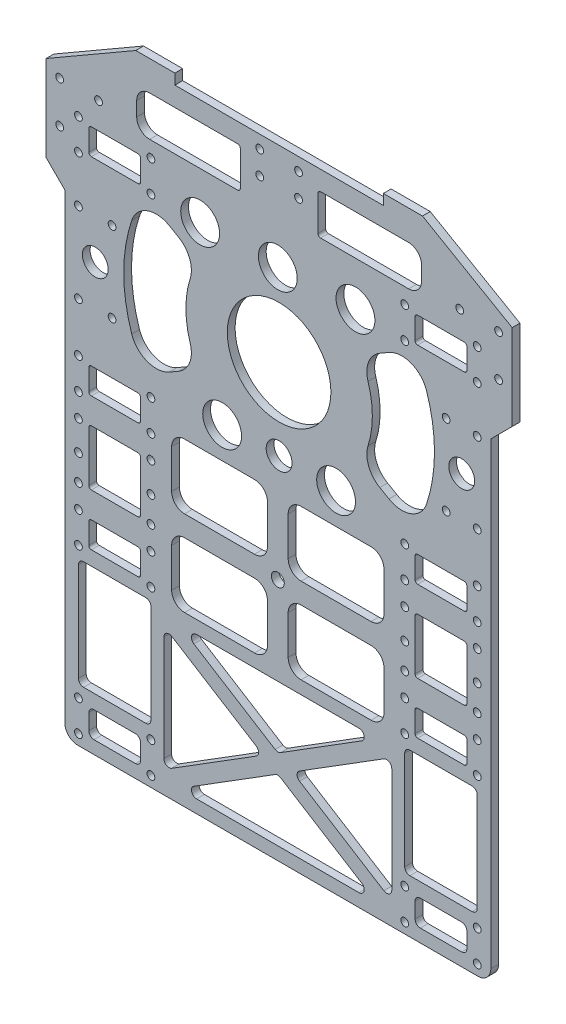
from build123d import *

# Parameters (mm, degrees)
SKETCH_1_W           = 201
SKETCH_1_H           = 195
EXTRUDE_1_DEPTH      = 3
CHAMFER_1_SIZE       = 25
CHAMFER_1_SIZE2      = 43.301270189
CUT_EXTRUDE_6_DEPTH  = 10
SKETCH_15_R          = 20
CUT_EXTRUDE_7_DEPTH  = 10
SKETCH_16_W          = 37
SKETCH_16_H          = 29.94024066
CUT_EXTRUDE_9_DEPTH  = 10
FILLET_1_R           = 5
FILLET_4_R           = 10
SKETCH_17_R          = 1.5
CUT_EXTRUDE_10_DEPTH = 5
EXTRUDE_2_DEPTH      = 3
CHAMFER_3_SIZE       = 10
SKETCH_27_W          = 20
SKETCH_27_H          = 10
CUT_EXTRUDE_16_DEPTH = 9
FILLET_6_R           = 1
SKETCH_30_W          = 106.00409404
SKETCH_30_H          = 23.924993188
SKETCH_30_W_2        = 94.165842559
SKETCH_30_H_2        = 28.711237986
SKETCH_30_W_3        = 217.804214652
SKETCH_30_H_3        = 38.306819749
CUT_EXTRUDE_18_DEPTH = 10
EXTRUDE_3_DEPTH      = 3
FILLET_7_R           = 2
CUT_EXTRUDE_19_DEPTH = 3
FILLET_8_R           = 5
FILLET_9_R           = 5
SKETCH_34_W          = 20
SKETCH_34_H          = 15
SKETCH_34_H_2        = 17.625664051
EXTRUDE_4_DEPTH      = 3
FILLET_12_R          = 10
SKETCH_35_R          = 1.5
CUT_EXTRUDE_21_DEPTH = 10
CUT_EXTRUDE_22_DEPTH = 10
FILLET_13_R          = 6
CUT_EXTRUDE_23_DEPTH = 10
FILLET_14_R          = 3
SKETCH_40_W          = 40
SKETCH_40_H          = 50
SKETCH_40_W_2        = 55
CUT_EXTRUDE_24_DEPTH = 10
SKETCH_41_W          = 15
SKETCH_41_H          = 40
SKETCH_41_H_2        = 32.09
CUT_EXTRUDE_25_DEPTH = 10
CUT_EXTRUDE_26_DEPTH = 10
SKETCH_43_W          = 180.29253832
SKETCH_43_H          = 3
EXTRUDE_6_DEPTH      = 4
SKETCH_44_W          = 3
SKETCH_44_H          = 4
EXTRUDE_7_DEPTH      = 4
EXTRUDE_8_DEPTH      = 3
FILLET_17_R          = 7
FILLET_18_R          = 9.01
SKETCH_46_W          = 40
SKETCH_46_H          = 15.5
CUT_EXTRUDE_27_DEPTH = 3
FILLET_21_R          = 60
FILLET_22_R          = 40
SKETCH_47_R          = 7.5
CUT_EXTRUDE_28_DEPTH = 3
SKETCH_48_W          = 166.350814393
SKETCH_48_H          = 15.90954676
CUT_EXTRUDE_29_DEPTH = 3
SKETCH_49_R          = 5
SKETCH_49_R_2        = 7.5
CUT_EXTRUDE_30_DEPTH = 3
SKETCH_51_W          = 20
SKETCH_51_H          = 50
EXTRUDE_9_DEPTH      = 3
SKETCH_52_W          = 8
SKETCH_52_H          = 8
CUT_EXTRUDE_31_DEPTH = 10
CUT_EXTRUDE_33_DEPTH = 10
SKETCH_56_W          = 43.293098597
SKETCH_56_H          = 76.973902965
CUT_EXTRUDE_34_DEPTH = 142.69186165
SKETCH_57_W          = 80.5
SKETCH_57_H          = 8.056183634
CUT_EXTRUDE_35_DEPTH = 121.593616884
CUT_EXTRUDE_36_DEPTH = 121.593616884
FILLET_25_R          = 10
SKETCH_59_R          = 1.5
CUT_EXTRUDE_37_DEPTH = 3
CHAMFER_5_SIZE       = 20
CHAMFER_5_SIZE2      = 34.641016151
CHAMFER_6_SIZE       = 20
CHAMFER_6_SIZE2      = 34.641016151
FILLET_26_R          = 5
CHAMFER_7_SIZE       = 10
EXTRUDE_START        = -3
EXTRUDE_10_DEPTH     = 3
SKETCH_62_W          = 180
SKETCH_62_H          = 3
EXTRUDE_11_DEPTH     = 50
SKETCH_63_W          = 20
SKETCH_63_H          = 10
SKETCH_63_R          = 1.5
CUT_EXTRUDE_38_DEPTH = 213.367228245
SKETCH_64_W          = 7.25
SKETCH_64_H          = 130.459459459
SKETCH_64_W_2        = 8.25
CUT_EXTRUDE_39_DEPTH = 213.367228245
SKETCH_65_W          = 20
SKETCH_65_H          = 21.459459459
SKETCH_65_R          = 1.5
CUT_EXTRUDE_40_DEPTH = 213.367228245
SKETCH_66_R          = 1.5
SKETCH_66_R_2        = 5
CUT_EXTRUDE_41_DEPTH = 213.367228245
CHAMFER_8_SIZE       = 8.25
CHAMFER_9_SIZE       = 7.25
FILLET_27_R          = 1
SKETCH_67_W          = 37
SKETCH_67_H          = 25.002895974
CUT_EXTRUDE_42_DEPTH = 10
FILLET_29_R          = 5
SKETCH_68_W          = 164.5
SKETCH_68_H          = 3
EXTRUDE_12_DEPTH     = 60
FILLET_31_R          = 5
SKETCH_70_R          = 2.5
CUT_EXTRUDE_44_DEPTH = 10
CUT_EXTRUDE_45_DEPTH = 3
FILLET_32_R          = 2
SKETCH_73_W          = 20
SKETCH_73_H          = 10
SKETCH_73_W_2        = 28
SKETCH_73_H_2        = 42
SKETCH_73_R          = 1.5
CUT_EXTRUDE_47_DEPTH = 259.498952301
FILLET_33_R          = 2
SKETCH_74_R          = 1.5
CUT_EXTRUDE_48_DEPTH = 259.498952301


# Some blends are built 0.0001 mm under size
with BuildPart() as part:
    # 草图1 → 凸台-拉伸1 (new body)
    with BuildSketch(Plane.XY):
        Rectangle(SKETCH_1_W, SKETCH_1_H)
    extrude(amount=EXTRUDE_1_DEPTH)

    # 倒角1
    chamfer_1_edges = [part.edges().sort_by_distance(p)[0] for p in [
        (-100.5, -97.5, 1.5),
    ]]
    chamfer_1_side = [part.faces().sort_by_distance(p)[0] for p in [
        (-100.5, 0, 1.5),
    ]]
    chamfer(chamfer_1_edges, length=CHAMFER_1_SIZE, length2=CHAMFER_1_SIZE2, reference=chamfer_1_side[0])

    # 草图14 → 切除-拉伸6 (cut)
    with BuildSketch(Plane(origin=(0, 0, 0), x_dir=(-1, 0, 0), z_dir=(0, 0, -1))):
        Polygon((-57.198729811, -97.5), (-100.5, -72.5), (-100.5, -97.5), align=None)
    extrude(amount=-CUT_EXTRUDE_6_DEPTH, mode=Mode.SUBTRACT)

    # 草图15 → 切除-拉伸7 (cut)
    with BuildSketch(Plane(origin=(0, 0, 0), x_dir=(-1, 0, 0), z_dir=(0, 0, -1))):
        with Locations((7, -5)):
            Circle(SKETCH_15_R)
        with BuildLine():
            Line((34.5, -77.5), (34.5, -97.5))
            Line((34.5, -97.5), (-20.5, -97.5))
            Line((-20.5, -97.5), (-20.5, -77.5))
            ThreePointArc((-20.5, -77.5), (7, -50), (34.5, -77.5))
        make_face()
    extrude(amount=-CUT_EXTRUDE_7_DEPTH, mode=Mode.SUBTRACT)

    # 草图16 → 切除-拉伸9 (cut)
    with BuildSketch(Plane(origin=(0, 0, 0), x_dir=(-1, 0, 0), z_dir=(0, 0, -1))):
        with Locations((6.00008928, 82.52987967)):
            Rectangle(SKETCH_16_W, SKETCH_16_H)
    extrude(amount=-CUT_EXTRUDE_9_DEPTH, mode=Mode.SUBTRACT)

    # 圆角1
    fillet_1_edges = [part.edges().sort_by_distance(p)[0] for p in [
        (12.49991072, 67.55975934, 1.5),
        (-24.50008928, 67.55975934, 1.5),
    ]]
    fillet(fillet_1_edges, radius=FILLET_1_R)

    # 圆角4
    fillet_4_edges = [part.edges().sort_by_distance(p)[0] for p in [
        (-34.5, -97.5, 1.5),
        (20.5, -97.5, 1.5),
    ]]
    fillet(fillet_4_edges, radius=FILLET_4_R)

    # 草图17 → 切除-拉伸10 (cut)
    with BuildSketch(Plane.XY.offset(3)):
        with Locations((0.5, 62.55975934)):
            Circle(SKETCH_17_R)
        with Locations((0.5, 53.55975934)):
            Circle(SKETCH_17_R)
        with Locations((-14.5, 53.55975934)):
            Circle(SKETCH_17_R)
        with Locations((-14.5, 62.55975934)):
            Circle(SKETCH_17_R)
    extrude(amount=-CUT_EXTRUDE_10_DEPTH, mode=Mode.SUBTRACT)

    # 草图19 → 凸台-拉伸2 (add)
    with BuildSketch(Plane.XY.offset(3)):
        with BuildLine():
            Line((107.337203466, 67.587851157), (100.5, 67.587851157))
            Line((100.5, 67.587851157), (100.5, 64.587851157))
            Line((100.5, 64.587851157), (115.5, 64.587851157))
            Line((115.5, 64.587851157), (115.5, 80.587851157))
            Line((115.5, 80.587851157), (100.5, 80.587851157))
            Line((100.5, 80.587851157), (100.5, 77.587851157))
            Line((100.5, 77.587851157), (107.337203466, 77.587851157))
            ThreePointArc((107.337203466, 77.587851157), (112.337203466, 72.587851157), (107.337203466, 67.587851157))
        make_face()
        with BuildLine():
            Line((100.5, 77.587851157), (100.5, 67.587851157))
            Line((100.5, 67.587851157), (107.337203466, 67.587851157))
            ThreePointArc((107.337203466, 67.587851157), (112.337203466, 72.587851157), (107.337203466, 77.587851157))
            Line((107.337203466, 77.587851157), (100.5, 77.587851157))
        make_face()
        with BuildLine():
            Line((-108.06494967, 74.962187106), (-100.5, 74.962187106))
            Line((-100.5, 74.962187106), (-100.5, 77.962187106))
            Line((-100.5, 77.962187106), (-116.5, 77.962187106))
            Line((-116.5, 77.962187106), (-116.5, 61.962187106))
            Line((-116.5, 61.962187106), (-100.5, 61.962187106))
            Line((-100.5, 61.962187106), (-100.5, 64.962187106))
            Line((-100.5, 64.962187106), (-108.06494967, 64.962187106))
            ThreePointArc((-108.06494967, 64.962187106), (-113.06494967, 69.962187106), (-108.06494967, 74.962187106))
        make_face()
        with BuildLine():
            Line((-100.5, 64.962187106), (-100.5, 74.962187106))
            Line((-100.5, 74.962187106), (-108.06494967, 74.962187106))
            ThreePointArc((-108.06494967, 74.962187106), (-113.06494967, 69.962187106), (-108.06494967, 64.962187106))
            Line((-108.06494967, 64.962187106), (-100.5, 64.962187106))
        make_face()
    extrude(amount=-EXTRUDE_2_DEPTH)

    # 倒角3
    chamfer_3_edges = [part.edges().sort_by_distance(p)[0] for p in [
        (100.5, 80.587851157, 1.5),
        (100.5, 64.587851157, 1.5),
        (-100.5, 61.962187106, 1.5),
        (-100.5, 77.962187106, 1.5),
    ]]
    chamfer(chamfer_3_edges, length=CHAMFER_3_SIZE)

    # 草图27 → 切除-拉伸16 (cut)
    with BuildSketch(Plane.XY.offset(3)):
        with Locations((-70.5, 32.5)):
            Rectangle(SKETCH_27_W, SKETCH_27_H)
        with Locations((-70.5, -47.5)):
            Rectangle(SKETCH_27_W, SKETCH_27_H)
        with Locations((55.5, -47.5)):
            Rectangle(SKETCH_27_W, SKETCH_27_H)
        with Locations((55.5, 32.5)):
            Rectangle(SKETCH_27_W, SKETCH_27_H)
    extrude(amount=-CUT_EXTRUDE_16_DEPTH, mode=Mode.SUBTRACT)

    # 圆角6
    fillet_6_edges = [part.edges().sort_by_distance(p)[0] for p in [
        (65.5, 37.5, 1.5),
        (65.5, 27.5, 1.5),
        (45.5, 27.5, 1.5),
        (45.5, 37.5, 1.5),
        (65.5, -42.5, 1.5),
        (65.5, -52.5, 1.5),
        (45.5, -52.5, 1.5),
        (45.5, -42.5, 1.5),
        (-60.5, -42.5, 1.5),
        (-60.5, -52.5, 1.5),
        (-80.5, -52.5, 1.5),
        (-80.5, -42.5, 1.5),
        (-60.5, 37.5, 1.5),
        (-60.5, 27.5, 1.5),
        (-80.5, 27.5, 1.5),
        (-80.5, 37.5, 1.5),
    ]]
    fillet(fillet_6_edges, radius=FILLET_6_R)

    # 草图30 → 切除-拉伸18 (cut)
    with BuildSketch(Plane.XY.offset(3)):
        with Locations((57.49795298, 92.550347751)):
            Rectangle(SKETCH_30_W, SKETCH_30_H)
        with Locations((-63.417078721, 92.317806099)):
            Rectangle(SKETCH_30_W_2, SKETCH_30_H_2)
        with Locations((8.402107326, -91.653409874)):
            Rectangle(SKETCH_30_W_3, SKETCH_30_H_3)
    extrude(amount=-CUT_EXTRUDE_18_DEPTH, mode=Mode.SUBTRACT)

    # 草图31 → 凸台-拉伸3 (add)
    with BuildSketch(Plane.XY.offset(3)):
        Polygon((-116.5, 61.962187106), (-100.5, 45.962187106), (-100.5, 51.962187106), (-110.5, 61.962187106), align=None)
        Polygon((115.5, 64.587851157), (100.5, 49.587851157), (100.5, 54.587851157), (110.5, 64.587851157), align=None)
    extrude(amount=-EXTRUDE_3_DEPTH)

    # 圆角7
    fillet_7_edges = [part.edges().sort_by_distance(p)[0] for p in [
        (115.5, 80.587851157, 1.5),
        (-116.5, 77.962187106, 1.5),
        (-24.50008928, 77.962187106, 1.5),
        (12.49991072, 80.587851157, 1.5),
    ]]
    fillet(fillet_7_edges, radius=FILLET_7_R)

    # 草图32 → 切除-拉伸19 (cut)
    with BuildSketch(Plane.XY.offset(3)):
        Polygon((-100.5, -72.5), (-100.5, -52.5), (-40.5, -72.5), align=None)
        Polygon((100.5, -72.5), (100.5, -52.5), (26.5, -72.5), align=None)
    extrude(amount=-CUT_EXTRUDE_19_DEPTH, mode=Mode.SUBTRACT)

    # 倒角4
    # the kernel refuses this chamfer: 12.476388681, 10 mm, written as the material it takes off along each edge
    with BuildSketch(Plane(origin=(20.041634566, -72.5, 26.497356815), x_dir=(-0.36639876698694906, 0.9304579214292517, 0), z_dir=(0, 0, -1))) as chamfer_4_piece_1:
        with BuildLine():
            Line((9.398942726, 0), (-3.299990577, 7.545636628))
            Line((-3.299990577, 7.545636628), (-3.53216567, 7.454209959))
            ThreePointArc((-3.53216567, 7.454209959), (-1.739907824, 3.737412261), (-0.232175094, -0.091426669))
            Line((-0.232175094, -0.091426669), (0.047689131, -0.244928268))
            ThreePointArc((0.047689131, -0.244928268), (4.6942867, 0.25159092), (9.36524124, -0.24724142))
            Line((9.36524124, -0.24724142), (9.398942726, 0))
        make_face()
    extrude(amount=49.99471363, mode=Mode.SUBTRACT)
    with BuildSketch(Plane(origin=(-34.041634566, -72.5, 26.497356815), x_dir=(-0.9993104470037873, -0.03712991393863708, 0), z_dir=(0, 0, -1))) as chamfer_4_piece_2:
        with BuildLine():
            Line((8.235688795, 0), (-3.766099375, 8.6114238))
            Line((-3.766099375, 8.6114238), (-3.979120942, 8.481477957))
            ThreePointArc((-3.979120942, 8.481477957), (-1.650461613, 4.401772606), (-0.243514956, -0.05444792))
            Line((-0.243514956, -0.05444792), (0.009264945, -0.249355711))
            ThreePointArc((0.009264945, -0.249355711), (4.121432356, -0.096565932), (8.244953739, -0.249355711))
            Line((8.244953739, -0.249355711), (8.235688795, 0))
        make_face()
    extrude(amount=49.99471363, mode=Mode.SUBTRACT)

    # 圆角8
    fillet_8_edges = [part.edges().sort_by_distance(p)[0] for p in [
        (-30.992270118, -64.060469704, 1.5),
        (16.992270118, -64.060469704, 1.5),
        (27.52125471, -72.223985214, 1.5),
        (-41.463164017, -72.178945328, 1.5),
    ]]
    fillet(fillet_8_edges, radius=FILLET_8_R)

    # 圆角9
    fillet_9_edges = [part.edges().sort_by_distance(p)[0] for p in [
        (-100.5, -52.5, 1.5),
        (100.5, -52.5, 1.5),
    ]]
    fillet(fillet_9_edges, radius=FILLET_9_R)

    # 草图34 → 凸台-拉伸4 (add)
    with BuildSketch(Plane(origin=(0, 0, 0), x_dir=(-1, 0, 0), z_dir=(0, 0, -1))):
        with Locations((-72.83991072, 88.087851157)):
            Rectangle(SKETCH_34_W, SKETCH_34_H)
        with Locations((84.84008928, 86.775019132)):
            Rectangle(SKETCH_34_W, SKETCH_34_H_2)
    extrude(amount=-EXTRUDE_4_DEPTH)

    # 圆角12
    fillet_12_edges = [part.edges().sort_by_distance(p)[0] for p in [
        (82.83991072, 80.587851157, 1.5),
        (62.83991072, 80.587851157, 1.5),
        (-94.84008928, 77.962187106, 1.5),
        (-74.84008928, 77.962187106, 1.5),
    ]]
    fillet(fillet_12_edges, radius=FILLET_12_R)

    # 草图35 → 切除-拉伸21 (cut)
    with BuildSketch(Plane(origin=(0, 0, 0), x_dir=(-1, 0, 0), z_dir=(0, 0, -1))):
        with Locations((-41.5, 38.5)):
            Circle(SKETCH_35_R)
        with Locations((-41.5, -53.5)):
            Circle(SKETCH_35_R)
        with Locations((-41.5, -41.5)):
            Circle(SKETCH_35_R)
        with Locations((-69.5, -41.5)):
            Circle(SKETCH_35_R)
        with Locations((-69.5, -53.5)):
            Circle(SKETCH_35_R)
        with Locations((84.5, 38.5)):
            Circle(SKETCH_35_R)
        with Locations((56.5, 26.5)):
            Circle(SKETCH_35_R)
        with Locations((56.5, 38.5)):
            Circle(SKETCH_35_R)
        with Locations((-69.5, 26.5)):
            Circle(SKETCH_35_R)
        with Locations((-69.5, 38.5)):
            Circle(SKETCH_35_R)
        with Locations((-41.5, 26.5)):
            Circle(SKETCH_35_R)
        with Locations((56.5, -53.5)):
            Circle(SKETCH_35_R)
        with Locations((56.5, -41.5)):
            Circle(SKETCH_35_R)
        with Locations((84.5, -53.5)):
            Circle(SKETCH_35_R)
        with Locations((84.5, -41.5)):
            Circle(SKETCH_35_R)
        with Locations((84.5, 26.5)):
            Circle(SKETCH_35_R)
    extrude(amount=-CUT_EXTRUDE_21_DEPTH, mode=Mode.SUBTRACT)

    # 草图38 → 切除-拉伸22 (cut)
    with BuildSketch(Plane.XY.offset(3)):
        Polygon((14.49991072, 67.55975934), (14.49991072, 80.587851157), (-26.613416478, 81.45380628), (-26.613416478, 67.55975934), align=None)
    extrude(amount=-CUT_EXTRUDE_22_DEPTH, mode=Mode.SUBTRACT)

    # 圆角13
    fillet_13_edges = [part.edges().sort_by_distance(p)[0] for p in [
        (14.49991072, 67.55975934, 1.5),
        (-26.613416478, 67.55975934, 1.5),
    ]]
    fillet(fillet_13_edges, radius=FILLET_13_R)

    # 草图39 → 切除-拉伸23 (cut)
    with BuildSketch(Plane.XY.offset(3)):
        Polygon((20.49991072, 80.587851157), (20.49991072, 67.587851157), (-30.7926276, 67.587851157), (-30.7926276, 84.869575288), (20.49991072, 84.869575288), align=None)
    extrude(amount=-CUT_EXTRUDE_23_DEPTH, mode=Mode.SUBTRACT)

    # 圆角14
    fillet_14_edges = [part.edges().sort_by_distance(p)[0] for p in [
        (20.49991072, 67.587851157, 1.5),
        (-30.7926276, 67.587851157, 1.5),
    ]]
    fillet(fillet_14_edges, radius=FILLET_14_R)

    # 草图40 → 切除-拉伸24 (cut)
    with BuildSketch(Plane.XY.offset(3)):
        with Locations((-80.5, -7.5)):
            Rectangle(SKETCH_40_W, SKETCH_40_H)
        with Locations((73, -7.5)):
            Rectangle(SKETCH_40_W_2, SKETCH_40_H)
    extrude(amount=-CUT_EXTRUDE_24_DEPTH, mode=Mode.SUBTRACT)

    # 草图41 → 切除-拉伸25 (cut)
    with BuildSketch(Plane.XY.offset(3)):
        with Locations((93, -52.5)):
            Rectangle(SKETCH_41_W, SKETCH_41_H)
        with Locations((93, 33.545)):
            Rectangle(SKETCH_41_W, SKETCH_41_H_2)
    extrude(amount=-CUT_EXTRUDE_25_DEPTH, mode=Mode.SUBTRACT)

    # 草图42 → 切除-拉伸26 (cut)
    with BuildSketch(Plane.XY.offset(3)):
        Polygon((-27.7926276, 67.587851157), (-87.7926276, 67.587851157), (-95.572555094, 77.962187106), (-104.84008928, 77.962187106), (-104.246385995, 83.985644331), (-97.769021468, 80.891119294), (-100.282319974, 112.192962905), (-22.186390259, 105.639458314), align=None)
        Polygon((17.49991072, 67.587851157), (92.49991072, 67.587851157), (92.49991072, 105.639458314), (9.662628015, 105.639458314), align=None)
    extrude(amount=-CUT_EXTRUDE_26_DEPTH, mode=Mode.SUBTRACT)

    # 草图43 → 凸台-拉伸6 (add)
    with BuildSketch(Plane(origin=(0, 67.587851157, 0), x_dir=(1, 0, 0), z_dir=(0, 1, 0))):
        with Locations((2.35364156, -1.5)):
            Rectangle(SKETCH_43_W, SKETCH_43_H)
    extrude(amount=EXTRUDE_6_DEPTH)

    # 草图44 → 凸台-拉伸7 (add)
    with BuildSketch(Plane.ZY.offset(87.7926276)):
        with Locations((1.5, 69.587851157)):
            Rectangle(SKETCH_44_W, SKETCH_44_H)
    extrude(amount=EXTRUDE_7_DEPTH)

    # 草图45 → 凸台-拉伸8 (add)
    with BuildSketch(Plane(origin=(0, 0, 0), x_dir=(-1, 0, 0), z_dir=(0, 0, -1))):
        Polygon((95.572555094, 77.962187106), (90.792309712, 71.587851157), (90.792309712, 77.962187106), align=None)
    extrude(amount=-EXTRUDE_8_DEPTH)

    # 圆角17
    # the kernel refuses this fillet: 7 mm, written as the material it adds along each edge
    with BuildSketch(Plane(origin=(-90.792309712, 71.587851157, 3), x_dir=(1, 0, 0), z_dir=(0, 0, -1))) as fillet_17_piece_1:
        with BuildLine():
            CenterArc((6.971982824, -7), FILLET_17_R, 90, 84.872026753)
            Line((0, -6.374335949), (-0.139439656, -6.361822668))
            ThreePointArc((-0.139439656, -6.361822668), (-0.14, -3.187167975), (-0.14, 0))
            Line((-0.14, 0), (0, 0.14))
            Line((0, 0.14), (6.971982824, 0.14))
            Line((6.971982824, 0.14), (6.971982824, 0))
        make_face()
    extrude(amount=3)

    # 圆角18
    # the kernel refuses this fillet: 9.01 mm, written as the material it adds along each edge
    with BuildSketch(Plane(origin=(92.49991072, 71.587851157, 3), x_dir=(-1, 0, 0), z_dir=(0, 0, -1))) as fillet_18_piece_1_section:
        with BuildLine():
            CenterArc((FILLET_18_R, FILLET_18_R), FILLET_18_R, 180, 90)
            Line((0, FILLET_18_R), (0, 0))
            Line((0, 0), (FILLET_18_R, 0))
        make_face()
    fillet_18_piece_1 = extrude(amount=3, mode=Mode.PRIVATE)
    fillet_18_piece_1 = fillet_18_piece_1 - Plane(origin=(92.83991072, 90.587851157, 1.5), x_dir=(0, -1, 0), z_dir=(0, 0, 1)) * Cylinder(10, 43, mode=Mode.PRIVATE)
    add(fillet_18_piece_1)

    # 草图46 → 切除-拉伸27 (cut)
    with BuildSketch(Plane(origin=(0, 0, 0), x_dir=(-1, 0, 0), z_dir=(0, 0, -1))):
        with Locations((-28, 52.30975934)):
            Rectangle(SKETCH_46_W, SKETCH_46_H)
        with Locations((42, 52.30975934)):
            Rectangle(SKETCH_46_W, SKETCH_46_H)
    extrude(amount=-CUT_EXTRUDE_27_DEPTH, mode=Mode.SUBTRACT)

    # 圆角21
    # the kernel refuses this fillet: 60 mm, written as the material it adds along each edge
    with BuildSketch(Plane(origin=(-100.5, 45.962187106, 3), x_dir=(-0.7071067811866327, 0.7071067811864622, 0), z_dir=(0, 0, -1))) as fillet_21_piece_1:
        with BuildLine():
            CenterArc((24.895705166, -59.957108576), FILLET_21_R, 92.166571934, 42.833428066)
            Line((-17.530701705, -17.530701705), (-18.379229842, -16.682173567))
            Line((-18.379229842, -16.682173567), (-0.848528137, 0.848528137))
            Line((-0.848528137, 0.848528137), (0, 1.2))
            ThreePointArc((0, 1.2), (11.313708499, 1.2), (22.582051235, 1.199142172))
            Line((22.582051235, 1.199142172), (22.627416998, 0))
        make_face()
    extrude(amount=3)

    # 圆角22
    # the kernel refuses this fillet: 40 mm, written as the material it adds along each edge
    with BuildSketch(Plane(origin=(85.5, 49.59, 3), x_dir=(1, 0, 0), z_dir=(0, 0, -1))) as fillet_22_piece_1:
        with BuildLine():
            CenterArc((40, 31.224989992), FILLET_22_R, 180, 51.317812547)
            Line((0, 31.224989992), (-0.8, 31.224989992))
            Line((-0.8, 31.224989992), (-0.8, 0))
            Line((-0.8, 0), (0, -0.8))
            ThreePointArc((0, -0.8), (7.5, -0.8), (14.5, -0.6244998))
            Line((14.5, -0.6244998), (15, 0))
        make_face()
    extrude(amount=3)

    # 草图47 → 切除-拉伸28 (cut)
    with BuildSketch(Plane(origin=(0, 0, 0), x_dir=(-1, 0, 0), z_dir=(0, 0, -1))):
        with Locations((7.499999999, 26.5)):
            Circle(SKETCH_47_R)
        with Locations((37.499999999, 26.5)):
            Circle(SKETCH_47_R)
        with Locations((-22.485093404, 27.44560752)):
            Circle(SKETCH_47_R)
    extrude(amount=-CUT_EXTRUDE_28_DEPTH, mode=Mode.SUBTRACT)

    # 草图48 → 切除-拉伸29 (cut)
    with BuildSketch(Plane(origin=(0, 0, 0), x_dir=(-1, 0, 0), z_dir=(0, 0, -1))):
        with Locations((17.675407197, -69.914232839)):
            Rectangle(SKETCH_48_W, SKETCH_48_H)
    extrude(amount=-CUT_EXTRUDE_29_DEPTH, mode=Mode.SUBTRACT)

    # 草图49 → 切除-拉伸30 (cut)
    with BuildSketch(Plane(origin=(0, 0, 0), x_dir=(-1, 0, 0), z_dir=(0, 0, -1))):
        with Locations((7, -36.262289658)):
            Circle(SKETCH_49_R)
        with Locations((29, -36.953667511)):
            Circle(SKETCH_49_R_2)
        with Locations((-15, -36.953667511)):
            Circle(SKETCH_49_R_2)
    extrude(amount=-CUT_EXTRUDE_30_DEPTH, mode=Mode.SUBTRACT)

    # 草图51 → 凸台-拉伸9 (add)
    with BuildSketch(Plane.XY.offset(3)):
        with Locations((-70.5, -7.5)):
            Rectangle(SKETCH_51_W, SKETCH_51_H)
        with Locations((55.5, -7.5)):
            Rectangle(SKETCH_51_W, SKETCH_51_H)
    extrude(amount=-EXTRUDE_9_DEPTH)

    # 草图52 → 切除-拉伸31 (cut)
    with BuildSketch(Plane.XY.offset(3)):
        with Locations((107.337203466, 72.587851157)):
            Rectangle(SKETCH_52_W, SKETCH_52_H)
        with Locations((-108.06494967, 69.962187106)):
            Rectangle(SKETCH_52_W, SKETCH_52_H)
    extrude(amount=-CUT_EXTRUDE_31_DEPTH, mode=Mode.SUBTRACT)

    # 草图54 → 切除-拉伸33 (cut)
    with BuildSketch(Plane.XY.offset(3)):
        Polygon((75.5, -59.256756757), (75.5, -32.5), (85.5, -32.5), (85.5, -56.554054054), align=None)
        Polygon((-91, -55.666666667), (-91, -32.5), (-100.5, -32.5), (-100.5, -52.5), align=None)
    extrude(amount=-CUT_EXTRUDE_33_DEPTH, mode=Mode.SUBTRACT)

    # 草图56 → 切除-拉伸34 (cut, through all)
    with BuildSketch(Plane.XY.offset(3)):
        Polygon((-97, 17.5), (-97, 71.587851157), (-83.820326888, 71.587851157), (-97, 94.473902965), (-140.293098597, 94.473902965), (-140.293098597, 17.5), align=None)
        with Locations((104.646549299, 55.986951483)):
            Rectangle(SKETCH_56_W, SKETCH_56_H)
    extrude(amount=-CUT_EXTRUDE_34_DEPTH, mode=Mode.SUBTRACT)

    # 草图57 → 切除-拉伸35 (cut, through all)
    with BuildSketch(Plane.XY.offset(3)):
        with Locations((-7, 71.587851157)):
            Rectangle(SKETCH_57_W, SKETCH_57_H)
    extrude(amount=-CUT_EXTRUDE_35_DEPTH, mode=Mode.SUBTRACT)

    # 草图58 → 切除-拉伸36 (cut, through all)
    with BuildSketch(Plane.XY.offset(3)):
        with BuildLine():
            Line((24.176914536, 13), (44.961524227, 25))
            ThreePointArc((44.961524227, 25), (53, -5), (44.961524227, -35))
            Line((44.961524227, -35), (24.176914536, -23))
            ThreePointArc((24.176914536, -23), (29, -5), (24.176914536, 13))
        make_face()
        with BuildLine():
            Line((-38.176914536, -23), (-58.961524227, -35))
            ThreePointArc((-58.961524227, -35), (-67, -5), (-58.961524227, 25))
            Line((-58.961524227, 25), (-38.176914536, 13))
            ThreePointArc((-38.176914536, 13), (-43, -5), (-38.176914536, -23))
        make_face()
    extrude(amount=-CUT_EXTRUDE_36_DEPTH, mode=Mode.SUBTRACT)

    # 圆角25
    fillet_25_edges = [part.edges().sort_by_distance(p)[0] for p in [
        (24.176914536, -23, 1.5),
        (24.176914536, 13, 1.5),
        (44.961524227, 25, 1.5),
        (44.961524227, -35, 1.5),
        (-38.176914536, 13, 1.5),
        (-38.176914536, -23, 1.5),
        (-58.961524227, -35, 1.5),
        (-58.961524227, 25, 1.5),
    ]]
    fillet(fillet_25_edges, radius=FILLET_25_R)

    # 草图59 → 切除-拉伸37 (cut)
    with BuildSketch(Plane(origin=(-66.282070169, 39.05611311, 0), x_dir=(1, 0, 0), z_dir=(0, 0, -1))):
        with Locations(Location((144.032070169, 7.436594491, 0), (0, 0, 180))):
            Circle(SKETCH_59_R)
        with Locations(Location((144.032070169, -8.563405509, 0), (0, 0, 180))):
            Circle(SKETCH_59_R)
        with Locations(Location((129.032070169, -8.563405509, 0), (0, 0, 180))):
            Circle(SKETCH_59_R)
        with Locations(Location((-10.467929831, -8.563405509, 0), (0, 0, 180))):
            Circle(SKETCH_59_R)
        with Locations(Location((-25.467929831, -8.563405509, 0), (0, 0, 180))):
            Circle(SKETCH_59_R)
        with Locations(Location((-25.467929831, 7.436594491, 0), (0, 0, 180))):
            Circle(SKETCH_59_R)
    extrude(amount=-CUT_EXTRUDE_37_DEPTH, mode=Mode.SUBTRACT)

    # 倒角5
    chamfer_5_edges = [part.edges().sort_by_distance(p)[0] for p in [
        (83, 71.587851157, 1.5),
    ]]
    chamfer_5_side = [part.faces().sort_by_distance(p)[0] for p in [
        (83, 44.543925578, 1.5),
    ]]
    chamfer(chamfer_5_edges, length=CHAMFER_5_SIZE, length2=CHAMFER_5_SIZE2, reference=chamfer_5_side[0])

    # 倒角6
    chamfer_6_edges = [part.edges().sort_by_distance(p)[0] for p in [
        (-97, 71.587851157, 1.5),
    ]]
    chamfer_6_side = [part.faces().sort_by_distance(p)[0] for p in [
        (-97, 44.543925578, 1.5),
    ]]
    chamfer(chamfer_6_edges, length=CHAMFER_6_SIZE, length2=CHAMFER_6_SIZE2, reference=chamfer_6_side[0])

    # 圆角26
    fillet_26_edges = [part.edges().sort_by_distance(p)[0] for p in [
        (48, 44.55975934, 1.5),
        (48, 60.05975934, 1.5),
        (-62, 60.05975934, 1.5),
        (-62, 44.55975934, 1.5),
    ]]
    fillet(fillet_26_edges, radius=FILLET_26_R)

    # 倒角7
    chamfer_7_edges = [part.edges().sort_by_distance(p)[0] for p in [
        (-97, 17.5, 1.5),
        (83, 17.5, 1.5),
    ]]
    chamfer(chamfer_7_edges, length=CHAMFER_7_SIZE)

    # 草图61 → 凸台-拉伸10 (add)
    with BuildSketch(Plane.XY.offset(3).offset(EXTRUDE_START)):
        Polygon((-97, 27.5), (-97, -61.959459459), (-72.121621622, -61.959459459), (-91, -55.666666667), (-91, -32.5), (-80.5, -32.5), (-80.5, 17.5), (-87, 17.5), align=None)
        Polygon((83, 27.5), (73, 17.5), (65.5, 17.5), (65.5, -32.5), (75.5, -32.5), (75.5, -59.256756757), (65.5, -61.959459459), (83, -61.959459459), align=None)
        with BuildLine():
            Line((-29.687917483, -61.959459459), (15.687917483, -61.959459459))
            ThreePointArc((15.687917483, -61.959459459), (-7, -50), (-29.687917483, -61.959459459))
        make_face()
    extrude(amount=EXTRUDE_10_DEPTH)

    # 草图62 → 凸台-拉伸11 (add)
    with BuildSketch(Plane.XZ.offset(61.959459459)):
        with Locations((-7, 1.5)):
            Rectangle(SKETCH_62_W, SKETCH_62_H)
    extrude(amount=EXTRUDE_11_DEPTH)

    # 草图63 → 切除-拉伸38 (cut, through all)
    with BuildSketch(Plane(origin=(-66.282070169, 39.05611311, 3), x_dir=(-1, 0, 0), z_dir=(0, 0, 1))):
        with Locations((-121.782070169, 138.015572569)):
            Rectangle(SKETCH_63_W, SKETCH_63_H)
        with Locations((4.217929831, 138.015572569)):
            Rectangle(SKETCH_63_W, SKETCH_63_H)
        with Locations(Location((-135.782070169, 144.015572569, 0), (0, 0, 180))):
            Circle(SKETCH_63_R)
        with Locations(Location((-135.782070169, 132.015572569, 0), (0, 0, 180))):
            Circle(SKETCH_63_R)
        with Locations(Location((-107.782070169, 144.015572569, 0), (0, 0, 180))):
            Circle(SKETCH_63_R)
        with Locations(Location((-107.782070169, 132.015572569, 0), (0, 0, 180))):
            Circle(SKETCH_63_R)
        with Locations(Location((-9.782070169, 144.015572569, 0), (0, 0, 180))):
            Circle(SKETCH_63_R)
        with Locations(Location((-9.782070169, 132.015572569, 0), (0, 0, 180))):
            Circle(SKETCH_63_R)
        with Locations(Location((18.217929831, 144.015572569, 0), (0, 0, 180))):
            Circle(SKETCH_63_R)
        with Locations(Location((18.217929831, 132.015572569, 0), (0, 0, 180))):
            Circle(SKETCH_63_R)
    extrude(amount=-CUT_EXTRUDE_38_DEPTH, mode=Mode.SUBTRACT)

    # 草图64 → 切除-拉伸39 (cut, through all)
    with BuildSketch(Plane(origin=(-66.282070169, 39.05611311, 3), x_dir=(-1, 0, 0), z_dir=(0, 0, 1))):
        with Locations((27.092929831, 85.78584284)):
            Rectangle(SKETCH_64_W, SKETCH_64_H)
        with Locations((-145.157070169, 85.78584284)):
            Rectangle(SKETCH_64_W_2, SKETCH_64_H)
    extrude(amount=-CUT_EXTRUDE_39_DEPTH, mode=Mode.SUBTRACT)

    # 草图65 → 切除-拉伸40 (cut, through all)
    with BuildSketch(Plane(origin=(-66.282070169, 39.05611311, 3), x_dir=(-1, 0, 0), z_dir=(0, 0, 1))):
        with Locations((-121.782070169, 112.28584284)):
            Rectangle(SKETCH_65_W, SKETCH_65_H)
        with Locations((4.217929831, 112.28584284)):
            Rectangle(SKETCH_65_W, SKETCH_65_H)
        with Locations(Location((-135.782070169, 123.015572569, 0), (0, 0, 180))):
            Circle(SKETCH_65_R)
        with Locations(Location((-135.782070169, 101.55611311, 0), (0, 0, 180))):
            Circle(SKETCH_65_R)
        with Locations(Location((-107.782070169, 123.015572569, 0), (0, 0, 180))):
            Circle(SKETCH_65_R)
        with Locations(Location((-107.782070169, 101.55611311, 0), (0, 0, 180))):
            Circle(SKETCH_65_R)
        with Locations(Location((18.217929831, 123.015572569, 0), (0, 0, 180))):
            Circle(SKETCH_65_R)
        with Locations(Location((18.217929831, 101.55611311, 0), (0, 0, 180))):
            Circle(SKETCH_65_R)
        with Locations(Location((-9.782070169, 101.55611311, 0), (0, 0, 180))):
            Circle(SKETCH_65_R)
        with Locations(Location((-9.782070169, 123.015572569, 0), (0, 0, 180))):
            Circle(SKETCH_65_R)
    extrude(amount=-CUT_EXTRUDE_40_DEPTH, mode=Mode.SUBTRACT)

    # 草图66 → 切除-拉伸41 (cut, through all)
    with BuildSketch(Plane(origin=(-66.282070169, 39.05611311, 3), x_dir=(-1, 0, 0), z_dir=(0, 0, 1))):
        with Locations(Location((5.21810839, 61.55611311, 0), (0, 0, 180))):
            Circle(SKETCH_66_R)
        with Locations(Location((18.217929831, 61.55611311, 0), (0, 0, 180))):
            Circle(SKETCH_66_R)
        with Locations(Location((5.21810839, 30.55611311, 0), (0, 0, 180))):
            Circle(SKETCH_66_R)
        with Locations(Location((18.217929831, 30.55611311, 0), (0, 0, 180))):
            Circle(SKETCH_66_R)
        with Locations(Location((-135.782070169, 30.55611311, 0), (0, 0, 180))):
            Circle(SKETCH_66_R)
        with Locations(Location((-123.782248728, 30.55611311, 0), (0, 0, 180))):
            Circle(SKETCH_66_R)
        with Locations(Location((-123.782248728, 61.55611311, 0), (0, 0, 180))):
            Circle(SKETCH_66_R)
        with Locations(Location((-135.782070169, 61.55611311, 0), (0, 0, 180))):
            Circle(SKETCH_66_R)
        with Locations(Location((-129.782159449, 46.05611311, 0), (0, 0, 180))):
            Circle(SKETCH_66_R_2)
        with Locations(Location((11.718019111, 46.05611311, 0), (0, 0, 180))):
            Circle(SKETCH_66_R_2)
    extrude(amount=-CUT_EXTRUDE_41_DEPTH, mode=Mode.SUBTRACT)

    # 倒角8
    chamfer_8_edges = [part.edges().sort_by_distance(p)[0] for p in [
        (74.75, 18.5, 1.5),
    ]]
    chamfer(chamfer_8_edges, length=CHAMFER_8_SIZE - 0.0001)  # a hair under: the kernel refuses the full size

    # 倒角9
    chamfer_9_edges = [part.edges().sort_by_distance(p)[0] for p in [
        (-89.75, 18.5, 1.5),
    ]]
    chamfer(chamfer_9_edges, length=CHAMFER_9_SIZE - 0.0001)  # a hair under: the kernel refuses the full size

    # 圆角27
    fillet_27_edges = [part.edges().sort_by_distance(p)[0] for p in [
        (8, 60.05975934, 1.5),
        (8, 44.55975934, 1.5),
        (-22, 44.55975934, 1.5),
        (-22, 60.05975934, 1.5),
        (-80.5, -103.959459459, 1.5),
        (-80.5, -93.959459459, 1.5),
        (-60.5, -93.959459459, 1.5),
        (-60.5, -103.959459459, 1.5),
        (45.5, -103.959459459, 1.5),
        (45.5, -93.959459459, 1.5),
        (65.5, -93.959459459, 1.5),
        (65.5, -103.959459459, 1.5),
        (-80.5, -83.959459459, 1.5),
        (-80.5, -62.5, 1.5),
        (-60.5, -62.5, 1.5),
        (-60.5, -83.959459459, 1.5),
        (45.5, -83.959459459, 1.5),
        (45.5, -62.5, 1.5),
        (65.5, -62.5, 1.5),
        (65.5, -83.959459459, 1.5),
    ]]
    fillet(fillet_27_edges, radius=FILLET_27_R)

    # 草图67 → 切除-拉伸42 (cut)
    with BuildSketch(Plane(origin=(0, 0, 0), x_dir=(-1, 0, 0), z_dir=(0, 0, -1))):
        with Locations((-15, -61.455115498)):
            Rectangle(SKETCH_67_W, SKETCH_67_H)
        with Locations((30, -61.455115498)):
            Rectangle(SKETCH_67_W, SKETCH_67_H)
        with Locations((-15, -94.458011472)):
            Rectangle(SKETCH_67_W, SKETCH_67_H)
        with Locations((30, -94.458011472)):
            Rectangle(SKETCH_67_W, SKETCH_67_H)
    extrude(amount=-CUT_EXTRUDE_42_DEPTH, mode=Mode.SUBTRACT)

    # 圆角29
    fillet_29_edges = [part.edges().sort_by_distance(p)[0] for p in [
        (-11.5, -48.953667511, 1.5),
        (-48.5, -48.953667511, 1.5),
        (-48.5, -73.956563485, 1.5),
        (-11.5, -73.956563485, 1.5),
        (-3.5, -81.956563485, 1.5),
        (-3.5, -106.959459459, 1.5),
        (33.5, -106.959459459, 1.5),
        (33.5, -81.956563485, 1.5),
        (-11.5, -81.956563485, 1.5),
        (-48.5, -81.956563485, 1.5),
        (-48.5, -106.959459459, 1.5),
        (-11.5, -106.959459459, 1.5),
        (33.5, -73.956563485, 1.5),
        (33.5, -48.953667511, 1.5),
        (-3.5, -48.953667511, 1.5),
        (-3.5, -73.956563485, 1.5),
    ]]
    fillet(fillet_29_edges, radius=FILLET_29_R)

    # 草图68 → 凸台-拉伸12 (add)
    with BuildSketch(Plane.XZ.offset(111.959459459)):
        with Locations((-7.5, 1.5)):
            Rectangle(SKETCH_68_W, SKETCH_68_H)
    extrude(amount=EXTRUDE_12_DEPTH)

    # 圆角31
    fillet_31_edges = [part.edges().sort_by_distance(p)[0] for p in [
        (74.75, -171.959459459, 1.5),
        (-89.75, -171.959459459, 1.5),
    ]]
    fillet(fillet_31_edges, radius=FILLET_31_R)

    # 草图70 → 切除-拉伸44 (cut)
    with BuildSketch(Plane(origin=(0, 0, 0), x_dir=(-1, 0, 0), z_dir=(0, 0, -1))):
        with Locations((7.5, -77.956563485)):
            Circle(SKETCH_70_R)
    extrude(amount=-CUT_EXTRUDE_44_DEPTH, mode=Mode.SUBTRACT)

    # 草图71 → 切除-拉伸45 (cut)
    with BuildSketch(Plane(origin=(0, 0, 0), x_dir=(-1, 0, 0), z_dir=(0, 0, -1))):
        Polygon((-30.839611321, -166.959459459), (45.839611321, -166.959459459), (7.5, -142.997202384), align=None)
        Polygon((-36.5, -163.421716535), (1.839611321, -139.459459459), (-36.5, -115.497202384), align=None)
        Polygon((13.160388679, -139.459459459), (51.5, -163.421716535), (51.5, -115.497202384), align=None)
        Polygon((-30.839611321, -111.959459459), (7.5, -135.921716535), (45.839611321, -111.959459459), align=None)
    extrude(amount=-CUT_EXTRUDE_45_DEPTH, mode=Mode.SUBTRACT)

    # 圆角32
    fillet_32_edges = [part.edges().sort_by_distance(p)[0] for p in [
        (-1.839611321, -139.459459459, 1.5),
        (36.5, -163.421716535, 1.5),
        (36.5, -115.497202384, 1.5),
        (-51.5, -115.497202384, 1.5),
        (-51.5, -163.421716535, 1.5),
        (-13.160388679, -139.459459459, 1.5),
        (-45.839611321, -111.959459459, 1.5),
        (-7.5, -135.921716535, 1.5),
        (30.839611321, -111.959459459, 1.5),
        (-7.5, -142.997202384, 1.5),
        (-45.839611321, -166.959459459, 1.5),
        (30.839611321, -166.959459459, 1.5),
    ]]
    fillet(fillet_32_edges, radius=FILLET_32_R)

    # 草图73 → 切除-拉伸47 (cut, through all)
    with BuildSketch(Plane(origin=(-66.282070169, 39.05611311, 3), x_dir=(-1, 0, 0), z_dir=(0, 0, 1))):
        with Locations((-121.782070169, 201.015572569)):
            Rectangle(SKETCH_73_W, SKETCH_73_H)
        with Locations((4.217929831, 201.015572569)):
            Rectangle(SKETCH_73_W, SKETCH_73_H)
        with Locations((-121.782070169, 169.515572569)):
            Rectangle(SKETCH_73_W_2, SKETCH_73_H_2)
        with Locations((4.217929831, 169.515572569)):
            Rectangle(SKETCH_73_W_2, SKETCH_73_H_2)
        with Locations(Location((-135.782070169, 207.015572569, 0), (0, 0, 180))):
            Circle(SKETCH_73_R)
        with Locations(Location((-135.782070169, 195.015572569, 0), (0, 0, 180))):
            Circle(SKETCH_73_R)
        with Locations(Location((-107.782070169, 207.015572569, 0), (0, 0, 180))):
            Circle(SKETCH_73_R)
        with Locations(Location((-107.782070169, 195.015572569, 0), (0, 0, 180))):
            Circle(SKETCH_73_R)
        with Locations(Location((18.217929831, 207.015572569, 0), (0, 0, 180))):
            Circle(SKETCH_73_R)
        with Locations(Location((18.217929831, 195.015572569, 0), (0, 0, 180))):
            Circle(SKETCH_73_R)
        with Locations(Location((-9.782070169, 207.015572569, 0), (0, 0, 180))):
            Circle(SKETCH_73_R)
        with Locations(Location((-9.782070169, 195.015572569, 0), (0, 0, 180))):
            Circle(SKETCH_73_R)
    extrude(amount=-CUT_EXTRUDE_47_DEPTH, mode=Mode.SUBTRACT)

    # 圆角33
    fillet_33_edges = [part.edges().sort_by_distance(p)[0] for p in [
        (-80.5, -166.959459459, 1.5),
        (-80.5, -156.959459459, 1.5),
        (-60.5, -156.959459459, 1.5),
        (-60.5, -166.959459459, 1.5),
        (-84.5, -151.459459459, 1.5),
        (-84.5, -109.459459459, 1.5),
        (-56.5, -109.459459459, 1.5),
        (-56.5, -151.459459459, 1.5),
        (41.5, -151.459459459, 1.5),
        (41.5, -109.459459459, 1.5),
        (69.5, -109.459459459, 1.5),
        (69.5, -151.459459459, 1.5),
        (45.5, -166.959459459, 1.5),
        (45.5, -156.959459459, 1.5),
        (65.5, -156.959459459, 1.5),
        (65.5, -166.959459459, 1.5),
    ]]
    fillet(fillet_33_edges, radius=FILLET_33_R)

    # 草图74 → 切除-拉伸48 (cut, through all)
    with BuildSketch(Plane(origin=(-66.282070169, 39.05611311, 3), x_dir=(-1, 0, 0), z_dir=(0, 0, 1))):
        with Locations(Location((-135.782070169, 113.015572569, 0), (0, 0, 180))):
            Circle(SKETCH_74_R)
        with Locations(Location((-107.782070169, 113.015572569, 0), (0, 0, 180))):
            Circle(SKETCH_74_R)
        with Locations(Location((-9.782070169, 113.015572569, 0), (0, 0, 180))):
            Circle(SKETCH_74_R)
        with Locations(Location((18.217929831, 113.015572569, 0), (0, 0, 180))):
            Circle(SKETCH_74_R)
    extrude(amount=-CUT_EXTRUDE_48_DEPTH, mode=Mode.SUBTRACT)


solid = part.part
